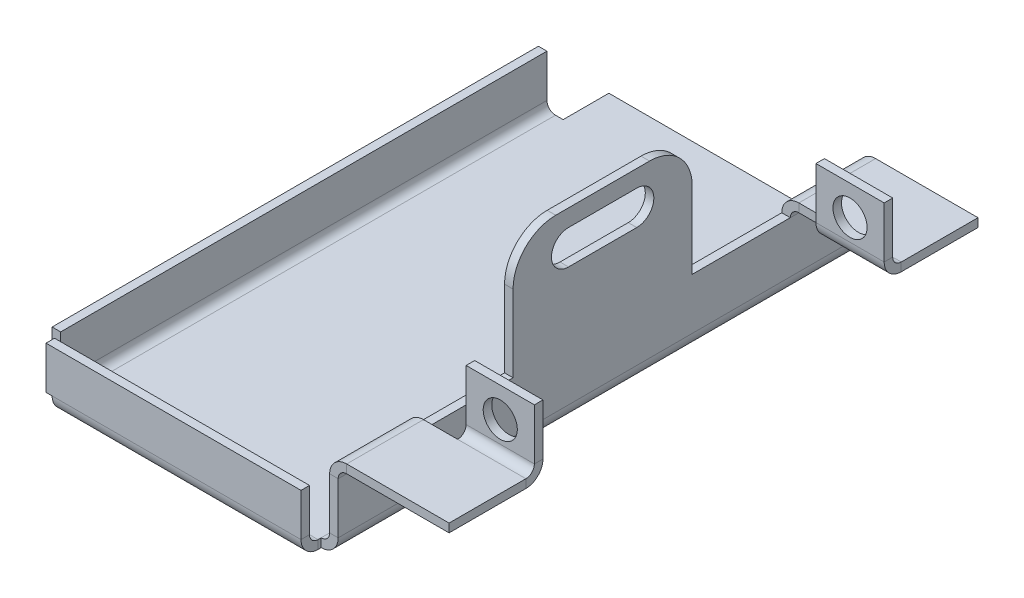
from build123d import *

# Parameters (mm, degrees)
Z_KLADN_PLECH1_DEPTH     = 62
LEM_Z_HRANY1_DEPTH       = 29.17
LEM_START                = 1
LEM_Z_HRANY1_PROFILE_W   = 29.89
LEM_Z_HRANY1_PROFILE_H   = 5
LEM_Z_HRANY1_FLAT_DEPTH  = 1
LEM_Z_HRANY2_DEPTH       = 57
SKICA12_W                = 5.36
SKICA12_H                = 1
ODEBRAT_VYSUNUT_M1_DEPTH = 0.9
OU_KO2_DEPTH             = 1
LEM_Z_HRANY3_DEPTH       = 9
LEM_Z_HRANY4_DEPTH       = 8
ODEBRAT_VYSUNUT_M2_REACH = 73.386
SKICA25_R                = 2
LEM_Z_HRANY5_DEPTH       = 9


# Sheet-metal steps are written as plain solids
with BuildPart() as part:
    # Skica1 → Základní plech1 (new body)
    with BuildSketch(Plane.XY):
        with BuildLine():
            Line((0, 0), (29.17, 0))
            ThreePointArc((29.17, 0), (29.877106781, 0.292893219), (30.17, 1))
            Line((30.17, 1), (30.17, 7))
            Line((30.17, 7), (31.17, 7))
            Line((31.17, 7), (31.17, 1))
            ThreePointArc((31.17, 1), (30.584213562, -0.414213562), (29.17, -1))
            Line((29.17, -1), (0, -1))
            Line((0, -1), (0, 0))
        make_face()
    extrude(amount=Z_KLADN_PLECH1_DEPTH)

    # Lem z hrany1 bend section (across the edge) → Lem z hrany1 (add)
    with BuildSketch(Plane(origin=(0, 0, 63.36), x_dir=(0, 0, -1), z_dir=(1, 0, 0))):
        with BuildLine():
            Line((-1, 1), (0, 1))
            ThreePointArc((0, 1), (0.292893219, 0.292893219), (1, 0))
            Line((1, 0), (1.36, 0))
            Line((1.36, 0), (1.36, -1))
            Line((1.36, -1), (1, -1))
            ThreePointArc((1, -1), (-0.414213562, -0.414213562), (-1, 1))
        make_face()
    extrude(amount=LEM_Z_HRANY1_DEPTH)

    # Lem z hrany1 profile (on flange) → Lem z hrany1 flat (add)
    with BuildSketch(Plane.XY.offset(63.36).offset(LEM_START)):
        with Locations((14.225, 3.5)):
            Rectangle(LEM_Z_HRANY1_PROFILE_W, LEM_Z_HRANY1_PROFILE_H)
    extrude(amount=-LEM_Z_HRANY1_FLAT_DEPTH)

    # Lem z hrany2 section (across the edge) → Lem z hrany2 (add)
    with BuildSketch(Plane(origin=(-1, 0, 5.36), x_dir=(1, 0, 0), z_dir=(0, 0, 1))):
        with BuildLine():
            Line((-1, 1), (-1, 6))
            Line((-1, 6), (0, 6))
            Line((0, 6), (0, 1))
            ThreePointArc((0, 1), (0.292893219, 0.292893219), (1, 0))
            Line((1, 0), (1, -1))
            ThreePointArc((1, -1), (-0.414213562, -0.414213562), (-1, 1))
        make_face()
    extrude(amount=LEM_Z_HRANY2_DEPTH)

    # Skica12 → Odebrat vysunutím1 (cut)
    with BuildSketch(Plane.ZY):
        with Locations((2.68, -0.5)):
            Rectangle(SKICA12_W, SKICA12_H)
    extrude(amount=-ODEBRAT_VYSUNUT_M1_DEPTH, mode=Mode.SUBTRACT)

    # Skica13 → Ouško2 (add)
    with BuildSketch(Plane.ZY.offset(-30.17)):
        with BuildLine():
            Line((20.5, 7), (20.5, 16))
            ThreePointArc((20.5, 16), (21.964466094, 19.535533906), (25.5, 21))
            Line((25.5, 21), (36.5, 21))
            ThreePointArc((36.5, 21), (40.035533906, 19.535533906), (41.5, 16))
            Line((41.5, 16), (41.5, 7))
            Line((41.5, 7), (20.5, 7))
        make_face()
        with BuildLine():
            Line((27, 19), (35, 19))
            ThreePointArc((35, 19), (37, 17), (35, 15))
            Line((35, 15), (27, 15))
            ThreePointArc((27, 15), (25, 17), (27, 19))
        make_face(mode=Mode.SUBTRACT)
    extrude(amount=-OU_KO2_DEPTH)

    # Lem z hrany3 section (across the edge) → Lem z hrany3 (add)
    with BuildSketch(Plane(origin=(31.17, 8, 53), x_dir=(0, -1, 0), z_dir=(0, 0, 1))):
        with BuildLine():
            Line((-1, 1), (-1, 13))
            Line((-1, 13), (0, 13))
            Line((0, 13), (0, 1))
            ThreePointArc((0, 1), (0.292893219, 0.292893219), (1, 0))
            Line((1, 0), (1, -1))
            ThreePointArc((1, -1), (-0.414213562, -0.414213562), (-1, 1))
        make_face()
    extrude(amount=LEM_Z_HRANY3_DEPTH)

    # Lem z hrany4 section (across the edge) → Lem z hrany4 (add)
    with BuildSketch(Plane(origin=(44.17, 9, 52), x_dir=(0, 0, 1), z_dir=(-1, 0, 0))):
        with BuildLine():
            Line((-1, 1), (-1, 7))
            Line((-1, 7), (0, 7))
            Line((0, 7), (0, 1))
            ThreePointArc((0, 1), (0.292893219, 0.292893219), (1, 0))
            Line((1, 0), (1, -1))
            ThreePointArc((1, -1), (-0.414213562, -0.414213562), (-1, 1))
        make_face()
    lem_z_hrany4 = extrude(amount=LEM_Z_HRANY4_DEPTH)

    # Skica25 → Odebrat vysunutím2 (cut, up to next)
    with BuildSketch(Plane.XY.offset(52), mode=Mode.PRIVATE) as odebrat_vysunut_m2_sk1:
        with Locations((40.17, 12.5)):
            Circle(SKICA25_R)
    odebrat_vysunut_m2_tool1 = extrude(odebrat_vysunut_m2_sk1.sketch, amount=-ODEBRAT_VYSUNUT_M2_REACH, mode=Mode.PRIVATE) & part.part
    odebrat_vysunut_m2 = odebrat_vysunut_m2_tool1.solids().sort_by_distance((40.17, 12.5, 52))[0]
    add(odebrat_vysunut_m2, mode=Mode.SUBTRACT)

    # Lem z hrany5 section (across the edge) → Lem z hrany5 (add)
    with BuildSketch(Plane(origin=(31.17, 8, 0), x_dir=(0, -1, 0), z_dir=(0, 0, 1))):
        with BuildLine():
            Line((-1, 1), (-1, 13))
            Line((-1, 13), (0, 13))
            Line((0, 13), (0, 1))
            ThreePointArc((0, 1), (0.292893219, 0.292893219), (1, 0))
            Line((1, 0), (1, -1))
            ThreePointArc((1, -1), (-0.414213562, -0.414213562), (-1, 1))
        make_face()
    extrude(amount=LEM_Z_HRANY5_DEPTH)

    # Zrcadlit1: Lem z hrany4, Odebrat vysunutím2 across plane
    add(lem_z_hrany4.mirror(Plane.XY.offset(31)))
    add(odebrat_vysunut_m2.mirror(Plane.XY.offset(31)), mode=Mode.SUBTRACT)


solid = part.part
